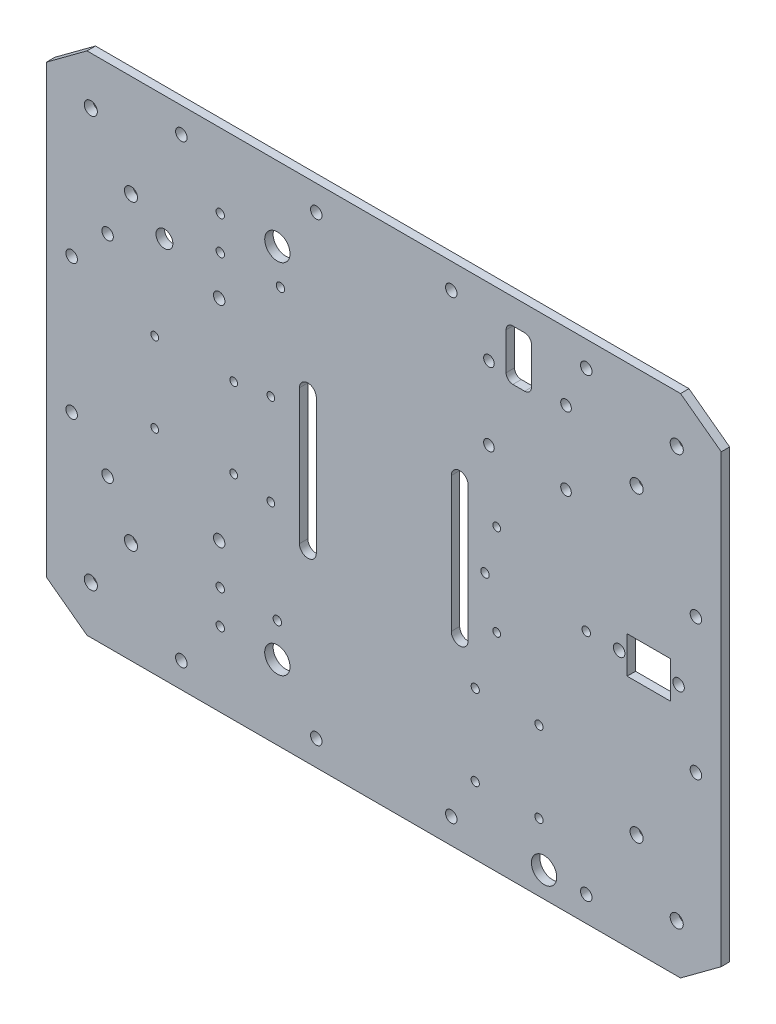
from build123d import *

# Parameters (mm, degrees)
SKETCH1_R                = 2.4638
BOSS_EXTRUDE1_DEPTH      = 3.175
SKETCH2_W                = 16.383
SKETCH2_H                = 13.843
SKETCH2_R                = 2.159
CUT_EXTRUDE1_DEPTH       = 159.781746826
SKETCH5_R                = 3.175
SKETCH5_R_2              = 2.159
SKETCH5_R_3              = 1.4478
CUT_EXTRUDE2_DEPTH       = 159.781746826
SKETCH6_R                = 2.159
CUT_EXTRUDE3_DEPTH       = 159.781746826
SKETCH5_3_R              = 1.45415
CUT_EXTRUDE4_DEPTH       = 159.781746826
SKETCH5_4_R              = 1.5875
SKETCH5_4_R_2            = 4.7625
CUT_EXTRUDE5_DEPTH       = 159.781746826
SKETCH5_5_R              = 1.5875
CUT_EXTRUDE6_DEPTH       = 2.54
SKETCH5_6_R              = 1.5875
CUT_EXTRUDE7_DEPTH       = 159.781746826
CUT_EXTRUDE8_DEPTH       = 7.62
CUT_EXTRUDE8_DEPTH_BACK  = 2.54
SKETCH5_7_W              = 9.525
SKETCH5_7_H              = 19.05
SKETCH5_7_R              = 1.5875
SKETCH5_9_R              = 1.5875
CUT_EXTRUDE9_DEPTH       = 159.781746826
CUT_EXTRUDE17_DEPTH      = 159.781746826
CUT_EXTRUDE17_DEPTH_BACK = 159.781746826
SKETCH5_15_W             = 9.525
SKETCH5_15_H             = 19.05
FILLET1_R                = 2.54
FILLET2_R                = 2.54
FILLET3_R                = 2.54
FILLET4_R                = 2.54
SKETCH9_R                = 1.55
SKETCH9_R_2              = 2
SKETCH9_R_3              = 1.5875
CUT_EXTRUDE18_DEPTH      = 159.781746826


with BuildPart() as part:
    # Sketch1 → Boss-Extrude1 (new body)
    with BuildSketch(Plane.XY):
        Polygon((-111.686526805, -95.25), (-127, -83.918625912), (-127, 83.918625912), (-111.686526805, 95.25), (111.686526805, 95.25), (127, 83.918625912), (127, -83.918625912), (111.686526805, -95.25), align=None)
        with Locations((-95.147512794, 56.885632681)):
            Circle(SKETCH1_R, mode=Mode.SUBTRACT)
        with Locations((-110.256011578, 77.303596941)):
            Circle(SKETCH1_R, mode=Mode.SUBTRACT)
        with Locations((110.256011578, 77.303596941)):
            Circle(SKETCH1_R, mode=Mode.SUBTRACT)
        with Locations((95.147512794, 56.885632681)):
            Circle(SKETCH1_R, mode=Mode.SUBTRACT)
        with Locations((-110.256011578, -77.303596941)):
            Circle(SKETCH1_R, mode=Mode.SUBTRACT)
        with Locations((-95.147512794, -56.885632681)):
            Circle(SKETCH1_R, mode=Mode.SUBTRACT)
        with Locations((110.256011578, -77.303596941)):
            Circle(SKETCH1_R, mode=Mode.SUBTRACT)
        with Locations((95.147512794, -56.885632681)):
            Circle(SKETCH1_R, mode=Mode.SUBTRACT)
    extrude(amount=BOSS_EXTRUDE1_DEPTH)

    # Sketch2 → Cut-Extrude1 (cut, through all)
    with BuildSketch(Plane.XY.offset(3.175)):
        with Locations((99.772576703, 0)):
            Rectangle(SKETCH2_W, SKETCH2_H)
        with Locations((110.948576703, 0)):
            Circle(SKETCH2_R)
        with Locations((88.596576703, 0)):
            Circle(SKETCH2_R)
    extrude(amount=-CUT_EXTRUDE1_DEPTH, mode=Mode.SUBTRACT)

    # Sketch5 → Cut-Extrude2 (cut, through all)
    with BuildSketch(Plane(origin=(0, 0, 0), x_dir=(-1, 0, 0), z_dir=(0, 0, -1))):
        with Locations((82.55, 48.58004)):
            Circle(SKETCH5_R)
        with Locations((61.9506, -39.49954)):
            Circle(SKETCH5_R_2)
        with Locations((103.9495, -39.49954)):
            Circle(SKETCH5_R_2)
        with Locations((103.9495, 39.49954)):
            Circle(SKETCH5_R_2)
        with Locations((61.9506, 39.49954)):
            Circle(SKETCH5_R_2)
        with BuildLine():
            Line((-31.75, 25.4), (-31.75, -25.4))
            ThreePointArc((-31.75, -25.4), (-28.575, -28.575), (-25.4, -25.4))
            Line((-25.4, -25.4), (-25.4, 25.4))
            ThreePointArc((-25.4, 25.4), (-28.575, 28.575), (-31.75, 25.4))
        make_face()
        with Locations((86.197426463, 15.03413)):
            Circle(SKETCH5_R_3)
        with Locations((56.479426463, 15.03413)):
            Circle(SKETCH5_R_3)
        with Locations((56.479426463, -15.03413)):
            Circle(SKETCH5_R_3)
        with Locations((86.197426463, -15.03413)):
            Circle(SKETCH5_R_3)
        with BuildLine():
            ThreePointArc((31.75, 25.4), (28.575, 28.575), (25.4, 25.4))
            Line((25.4, 25.4), (25.4, -25.4))
            ThreePointArc((25.4, -25.4), (28.575, -28.575), (31.75, -25.4))
            Line((31.75, -25.4), (31.75, 25.4))
        make_face()
    extrude(amount=-CUT_EXTRUDE2_DEPTH, mode=Mode.SUBTRACT)

    # Sketch6 → Cut-Extrude3 (cut, through all)
    with BuildSketch(Plane(origin=(0, 0, 0), x_dir=(-1, 0, 0), z_dir=(0, 0, -1))):
        with Locations((-76.2, -85.725)):
            Circle(SKETCH6_R)
        with Locations((-25.4, -85.725)):
            Circle(SKETCH6_R)
        with Locations((25.4, -85.725)):
            Circle(SKETCH6_R)
        with Locations((76.2, -85.725)):
            Circle(SKETCH6_R)
        with Locations((76.2, 85.725)):
            Circle(SKETCH6_R)
        with Locations((25.4, 85.725)):
            Circle(SKETCH6_R)
        with Locations((-25.4, 85.725)):
            Circle(SKETCH6_R)
        with Locations((-76.2, 85.725)):
            Circle(SKETCH6_R)
        with Locations((117.475, -25.4)):
            Circle(SKETCH6_R)
        with Locations((117.475, 25.4)):
            Circle(SKETCH6_R)
        with Locations((-117.475, 25.4)):
            Circle(SKETCH6_R)
        with Locations((-117.475, -25.4)):
            Circle(SKETCH6_R)
    extrude(amount=-CUT_EXTRUDE3_DEPTH, mode=Mode.SUBTRACT)

    # Sketch5<3> → Cut-Extrude4 (cut, through all)
    with BuildSketch(Plane(origin=(0, 0, 0), x_dir=(-1, 0, 0), z_dir=(0, 0, -1))):
        with Locations((-42.5, 17.2)):
            Circle(SKETCH5_3_R)
        with Locations((-42.5, -17.2)):
            Circle(SKETCH5_3_R)
        with Locations((42.5, -17.2)):
            Circle(SKETCH5_3_R)
        with Locations((42.5, 17.2)):
            Circle(SKETCH5_3_R)
    extrude(amount=-CUT_EXTRUDE4_DEPTH, mode=Mode.SUBTRACT)

    # Sketch5<4> → Cut-Extrude5 (cut, through all)
    with BuildSketch(Plane(origin=(0, 0, 0), x_dir=(-1, 0, 0), z_dir=(0, 0, -1))):
        with Locations((61.544630637, -54.61)):
            Circle(SKETCH5_4_R)
        with Locations((61.544630637, -67.31)):
            Circle(SKETCH5_4_R)
        with Locations((-60.325, -85.725)):
            Circle(SKETCH5_4_R_2)
        with Locations((61.544630637, 54.61)):
            Circle(SKETCH5_4_R)
        with Locations((40.055369363, -67.31)):
            Circle(SKETCH5_4_R_2)
        with Locations((61.544630637, 67.31)):
            Circle(SKETCH5_4_R)
        with Locations((40.055369363, 67.31)):
            Circle(SKETCH5_4_R_2)
    extrude(amount=-CUT_EXTRUDE5_DEPTH, mode=Mode.SUBTRACT)

    # Sketch5<5> → Cut-Extrude6 (cut)
    with BuildSketch(Plane(origin=(0, 0, 0), x_dir=(-1, 0, 0), z_dir=(0, 0, -1))):
        with Locations((38.886108088, 54.61)):
            Circle(SKETCH5_5_R)
    extrude(amount=-CUT_EXTRUDE6_DEPTH, mode=Mode.SUBTRACT)

    # Sketch5<6> → Cut-Extrude7 (cut, through all)
    with BuildSketch(Plane(origin=(0, 0, 0), x_dir=(-1, 0, 0), z_dir=(0, 0, -1))):
        with Locations((38.886108088, 54.61)):
            Circle(SKETCH5_6_R)
    extrude(amount=-CUT_EXTRUDE7_DEPTH, mode=Mode.SUBTRACT)

    # Sketch5<7> → Cut-Extrude8 (cut, two sides: drawn at the far end of the back side and taken through both)
    with BuildSketch(Plane(origin=(0, 0, 0), x_dir=(-1, 0, 0), z_dir=(0, 0, -1)).offset(-CUT_EXTRUDE8_DEPTH_BACK)):
        with Locations((-50.8, 76.2)):
            Rectangle(SKETCH5_7_W, SKETCH5_7_H)
        with Locations((40.055369363, -54.61)):
            Circle(SKETCH5_7_R)
    extrude(amount=CUT_EXTRUDE8_DEPTH + CUT_EXTRUDE8_DEPTH_BACK, mode=Mode.SUBTRACT)

    # Sketch5<9> → Cut-Extrude9 (cut, through all)
    with BuildSketch(Plane(origin=(0, 0, 0), x_dir=(-1, 0, 0), z_dir=(0, 0, -1))):
        with Locations((40.055369363, -54.61)):
            Circle(SKETCH5_9_R)
    extrude(amount=-CUT_EXTRUDE9_DEPTH, mode=Mode.SUBTRACT)

    # Sketch5<15> → Cut-Extrude17 (cut, two sides: drawn at the far end of the back side and taken through both)
    with BuildSketch(Plane(origin=(0, 0, 0), x_dir=(-1, 0, 0), z_dir=(0, 0, -1)).offset(-CUT_EXTRUDE17_DEPTH_BACK)):
        with Locations((-50.8, 76.2)):
            Rectangle(SKETCH5_15_W, SKETCH5_15_H)
    extrude(amount=CUT_EXTRUDE17_DEPTH + CUT_EXTRUDE17_DEPTH_BACK, mode=Mode.SUBTRACT)

    # Fillet1
    fillet1_edges = [part.edges().sort_by_distance(p)[0] for p in [
        (55.5625, 85.725, 1.5875),
    ]]
    fillet(fillet1_edges, radius=FILLET1_R)

    # Fillet2
    fillet2_edges = [part.edges().sort_by_distance(p)[0] for p in [
        (46.0375, 85.725, 1.5875),
    ]]
    fillet(fillet2_edges, radius=FILLET2_R)

    # Fillet3
    fillet3_edges = [part.edges().sort_by_distance(p)[0] for p in [
        (46.0375, 66.675, 1.5875),
    ]]
    fillet(fillet3_edges, radius=FILLET3_R)

    # Fillet4
    fillet4_edges = [part.edges().sort_by_distance(p)[0] for p in [
        (55.5625, 66.675, 1.5875),
    ]]
    fillet(fillet4_edges, radius=FILLET4_R)

    # Sketch9 → Cut-Extrude18 (cut, through all)
    with BuildSketch(Plane.XY.offset(3.175)):
        with Locations((34.42, -39.45)):
            Circle(SKETCH9_R)
        with Locations((58.42, -39.45)):
            Circle(SKETCH9_R)
        with Locations((58.42, -69.85)):
            Circle(SKETCH9_R)
        with Locations((34.42, -69.85)):
            Circle(SKETCH9_R)
        with Locations((68.58, 69.85)):
            Circle(SKETCH9_R_2)
        with Locations((39.58, 69.85)):
            Circle(SKETCH9_R_2)
        with Locations((39.58, 42.35)):
            Circle(SKETCH9_R_2)
        with Locations((68.58, 42.35)):
            Circle(SKETCH9_R_2)
        with Locations((76.2, 0)):
            Circle(SKETCH9_R_3)
        with Locations((38.1, 0)):
            Circle(SKETCH9_R_3)
    extrude(amount=-CUT_EXTRUDE18_DEPTH, mode=Mode.SUBTRACT)


solid = part.part
